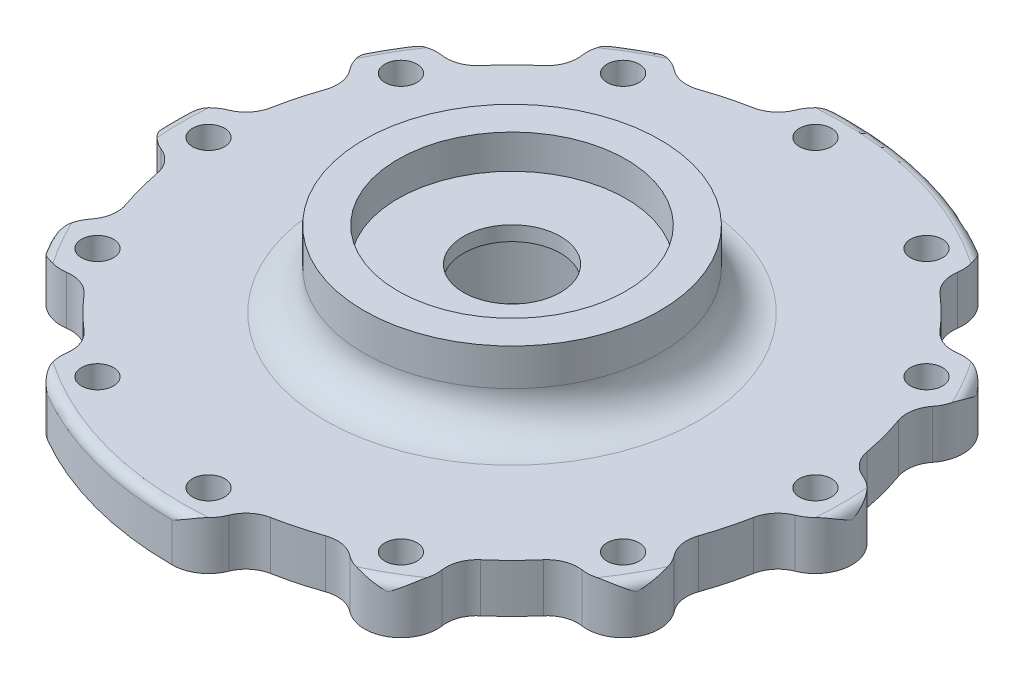
from build123d import *

# Parameters (mm, degrees)
M6_CLEARANCE_HOLE1_D = 6.6
M6_CLEARANCE_HOLE2_D = 6.6
CUT_EXTRUDE1_DEPTH   = 101.216565567


with BuildPart() as part:
    # Sketch1 → Revolve1 (revolve)
    with BuildSketch(Plane.XY):
        with BuildLine():
            Line((-70, -26.698290186), (-45, -26.698290186))
            Line((-45, -26.698290186), (-45, -31.698290186))
            Line((-45, -31.698290186), (-40, -31.698290186))
            Line((-40, -31.698290186), (-23.5, -31.698290186))
            Line((-23.5, -31.698290186), (-23.5, -11.098290186))
            Line((-23.5, -11.098290186), (-10, -11.098290186))
            Line((-10, -11.098290186), (-10, -8.098290186))
            Line((-10, -8.098290186), (-23.5, -8.098290186))
            Line((-23.5, -8.098290186), (-23.5, -1.098290186))
            Line((-23.5, -1.098290186), (-30.5, -1.098290186))
            Line((-30.5, -1.098290186), (-30.5, -8.698290186))
            ThreePointArc((-30.5, -8.698290186), (-32.843145751, -14.355144435), (-38.5, -16.698290186))
            Line((-38.5, -16.698290186), (-68, -16.698290186))
            ThreePointArc((-68, -16.698290186), (-69.414213562, -17.284076623), (-70, -18.698290186))
            Line((-70, -18.698290186), (-70, -26.698290186))
        make_face()
    revolve(axis=Axis((0, 95.786399453, 0), (0, -1, 0)))

    # M6 Clearance Hole1 (through all)
    with Locations(Plane(origin=(0, -16.698290186, 0), x_dir=(1, 0, 0), z_dir=(0, 1, 0))):
        with Locations((-31.25, 54.126587737), (0, 62.5), (31.25, 54.126587737), (54.126587737, 31.25), (62.5, 0), (54.126587737, -31.25), (31.25, -54.126587737), (0, -62.5), (-31.25, -54.126587737), (-54.126587737, -31.25), (-62.5, 0), (-54.126587737, 31.25)):
            Hole(M6_CLEARANCE_HOLE1_D / 2)

    # M6 Clearance Hole2 (through all)
    with Locations(Plane(origin=(0, -16.698290186, 0), x_dir=(1, 0, 0), z_dir=(0, 1, 0))):
        with Locations((0, 0), (31.25, -54.126587737), (0, -62.5), (-31.25, -54.126587737), (-54.126587737, -31.25), (-62.5, 0), (-54.126587737, 31.25), (-31.25, 54.126587737), (0, 62.5), (31.25, 54.126587737), (54.126587737, 31.25), (62.5, 0), (54.126587737, -31.25)):
            Hole(M6_CLEARANCE_HOLE2_D / 2)

    # Sketch6 → Cut-Extrude1 (cut, through all)
    with BuildSketch(Plane(origin=(0, -16.698290186, 0), x_dir=(1, 0, 0), z_dir=(0, 1, 0))):
        with BuildLine():
            ThreePointArc((-65.282310469, 6.964822213), (-62.737859465, 8.823001918), (-61.399782135, 11.675476597))
            ThreePointArc((-61.399782135, 11.675476597), (-60.370364143, 16.176190319), (-59.011509414, 20.588631733))
            ThreePointArc((-59.011509414, 20.588631733), (-58.744081035, 23.727985934), (-60.01855039, 26.609442266))
            ThreePointArc((-60.01855039, 26.609442266), (-61.607279952, 30.712185928), (-60.621778022, 35.00000042))
            ThreePointArc((-60.621778022, 35.00000042), (-67.614807777, 18.117333392), (-70, 0))
            ThreePointArc((-70, 0), (-68.709562324, 4.206106958), (-65.282310469, 6.964822213))
        make_face()
        with BuildLine():
            ThreePointArc((-70, 0), (-67.614807848, -18.11733313), (-60.621778293, -34.999999951))
            ThreePointArc((-60.621778293, -34.999999951), (-61.607279933, -30.712185657), (-60.01855039, -26.609442266))
            ThreePointArc((-60.01855039, -26.609442266), (-58.744081035, -23.727985934), (-59.011509414, -20.588631733))
            ThreePointArc((-59.011509414, -20.588631733), (-60.370364143, -16.176190319), (-61.399782135, -11.675476597))
            ThreePointArc((-61.399782135, -11.675476597), (-62.737859465, -8.823001918), (-65.282310469, -6.964822213))
            ThreePointArc((-65.282310469, -6.964822213), (-68.709562324, -4.206106958), (-70, 0))
        make_face()
        with BuildLine():
            ThreePointArc((-34.999999481, 60.621778565), (-49.4974743, 49.497475067), (-60.621778022, 35.00000042))
            ThreePointArc((-60.621778022, 35.00000042), (-57.401172759, 37.997376745), (-53.053728178, 38.672868204))
            ThreePointArc((-53.053728178, 38.672868204), (-49.921079117, 39.009873531), (-47.336032817, 40.811150402))
            ThreePointArc((-47.336032817, 40.811150402), (-44.194173824, 44.194173824), (-40.811150402, 47.336032817))
            ThreePointArc((-40.811150402, 47.336032817), (-39.009873531, 49.921079117), (-38.672868204, 53.053728178))
            ThreePointArc((-38.672868204, 53.053728178), (-37.997376508, 57.401173246), (-34.999999481, 60.621778565))
        make_face()
        with BuildLine():
            ThreePointArc((-60.621778293, -34.999999951), (-49.497474703, -49.497474663), (-35, -60.621778265))
            ThreePointArc((-35, -60.621778265), (-37.997376639, -57.401172977), (-38.672868204, -53.053728178))
            ThreePointArc((-38.672868204, -53.053728178), (-39.009873531, -49.921079117), (-40.811150402, -47.336032817))
            ThreePointArc((-40.811150402, -47.336032817), (-44.194173824, -44.194173824), (-47.336032817, -40.811150402))
            ThreePointArc((-47.336032817, -40.811150402), (-49.921079117, -39.009873531), (-53.053728178, -38.672868204))
            ThreePointArc((-53.053728178, -38.672868204), (-57.401173003, -37.997376626), (-60.621778293, -34.999999951))
        make_face()
        with BuildLine():
            ThreePointArc((0, 70), (-18.117332868, 67.614807918), (-34.999999481, 60.621778565))
            ThreePointArc((-34.999999481, 60.621778565), (-30.712185387, 61.607279913), (-26.609442266, 60.01855039))
            ThreePointArc((-26.609442266, 60.01855039), (-23.727985934, 58.744081035), (-20.588631733, 59.011509414))
            ThreePointArc((-20.588631733, 59.011509414), (-16.176190319, 60.370364143), (-11.675476597, 61.399782135))
            ThreePointArc((-11.675476597, 61.399782135), (-8.823001918, 62.737859465), (-6.964822213, 65.282310469))
            ThreePointArc((-6.964822213, 65.282310469), (-4.206106958, 68.709562324), (0, 70))
        make_face()
        with BuildLine():
            ThreePointArc((0, -70), (18.117333229, -67.614807821), (35.000000128, -60.621778191))
            ThreePointArc((35.000000128, -60.621778191), (30.71218576, -61.60727994), (26.609442266, -60.01855039))
            ThreePointArc((26.609442266, -60.01855039), (23.727985934, -58.744081035), (20.588631733, -59.011509414))
            ThreePointArc((20.588631733, -59.011509414), (16.176190319, -60.370364143), (11.675476597, -61.399782135))
            ThreePointArc((11.675476597, -61.399782135), (8.823001918, -62.737859465), (6.964822213, -65.282310469))
            ThreePointArc((6.964822213, -65.282310469), (4.206106958, -68.709562324), (0, -70))
        make_face()
        with BuildLine():
            ThreePointArc((60.621778023, 35.000000419), (49.497474512, 49.497474854), (35, 60.621778265))
            ThreePointArc((35, 60.621778265), (37.997376639, 57.401172977), (38.672868204, 53.053728178))
            ThreePointArc((38.672868204, 53.053728178), (39.009873531, 49.921079117), (40.811150402, 47.336032817))
            ThreePointArc((40.811150402, 47.336032817), (44.194173824, 44.194173824), (47.336032817, 40.811150402))
            ThreePointArc((47.336032817, 40.811150402), (49.921079117, 39.009873531), (53.053728178, 38.672868204))
            ThreePointArc((53.053728178, 38.672868204), (57.401172759, 37.997376744), (60.621778023, 35.000000419))
        make_face()
        with BuildLine():
            ThreePointArc((35.000000128, -60.621778191), (49.497474504, -49.497474862), (60.621777938, -35.000000566))
            ThreePointArc((60.621777938, -35.000000566), (57.401172683, -37.997376781), (53.053728178, -38.672868204))
            ThreePointArc((53.053728178, -38.672868204), (49.921079117, -39.009873531), (47.336032817, -40.811150402))
            ThreePointArc((47.336032817, -40.811150402), (44.194173824, -44.194173824), (40.811150402, -47.336032817))
            ThreePointArc((40.811150402, -47.336032817), (39.009873531, -49.921079117), (38.672868204, -53.053728178))
            ThreePointArc((38.672868204, -53.053728178), (37.997376671, -57.40117291), (35.000000128, -60.621778191))
        make_face()
        with BuildLine():
            ThreePointArc((70, 0), (67.614807778, 18.117333391), (60.621778023, 35.000000419))
            ThreePointArc((60.621778023, 35.000000419), (61.607279952, 30.712185927), (60.01855039, 26.609442266))
            ThreePointArc((60.01855039, 26.609442266), (58.744081035, 23.727985934), (59.011509414, 20.588631733))
            ThreePointArc((59.011509414, 20.588631733), (60.370364143, 16.176190319), (61.399782135, 11.675476597))
            ThreePointArc((61.399782135, 11.675476597), (62.737859465, 8.823001918), (65.282310469, 6.964822213))
            ThreePointArc((65.282310469, 6.964822213), (68.709562324, 4.206106958), (70, 0))
        make_face()
        with BuildLine():
            ThreePointArc((60.621777938, -35.000000566), (67.614807756, -18.117333473), (70, 0))
            ThreePointArc((70, 0), (68.709562324, -4.206106958), (65.282310469, -6.964822213))
            ThreePointArc((65.282310469, -6.964822213), (62.737859465, -8.823001918), (61.399782135, -11.675476597))
            ThreePointArc((61.399782135, -11.675476597), (60.370364143, -16.176190319), (59.011509414, -20.588631733))
            ThreePointArc((59.011509414, -20.588631733), (58.744081035, -23.727985934), (60.01855039, -26.609442266))
            ThreePointArc((60.01855039, -26.609442266), (61.607279958, -30.712186011), (60.621777938, -35.000000566))
        make_face()
    extrude(amount=-CUT_EXTRUDE1_DEPTH, mode=Mode.SUBTRACT)


solid = part.part
